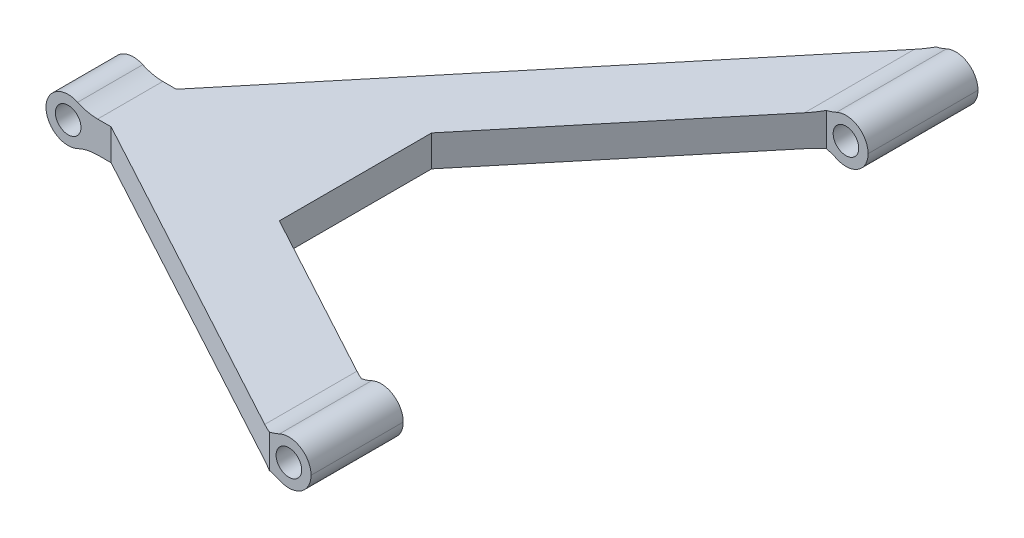
from build123d import *

# Parameters (mm, degrees)
BOSS_EXTRUDE1_DEPTH      = 2.38125
BOSS_EXTRUDE1_DEPTH_BACK = 2.38125
CUT_EXTRUDE1_DEPTH       = 68.891743782
CUT_EXTRUDE1_DEPTH_BACK  = 68.891743782
SKETCH2_R                = 1.375
FILLET2_R                = 2.38125
CUT_EXTRUDE2_DEPTH       = 61.804572212
CUT_EXTRUDE2_DEPTH_BACK  = 61.804572212


with BuildPart() as part:
    # Sketch1 → Boss-Extrude1 (new, two sides: drawn at the far end of the back side and taken through both)
    with BuildSketch(Plane(origin=(0, 0, 0), x_dir=(1, 0, 0), z_dir=(0, 1, 0)).offset(-BOSS_EXTRUDE1_DEPTH_BACK)):
        Polygon((0, 41.898993428), (-37, -2.75), (-44, -2.75), (-44, -9.75), (-37, -9.75), (0, -29.761006572), (4.489108528, -29.761006572), (4.489108528, -19.854089936), (0, -19.854089936), (-19.216520838, -9.461064942), (-19.216520838, 6.902295225), (0, 30.091438809), (4.489108528, 30.091438809), (4.489108528, 41.898993428), align=None)
    extrude(amount=BOSS_EXTRUDE1_DEPTH + BOSS_EXTRUDE1_DEPTH_BACK)

    # Sketch2 → Cut-Extrude1 (cut, two sides: drawn at the far end of the back side and taken through both)
    with BuildSketch(Plane.XY.offset(9.75).offset(-CUT_EXTRUDE1_DEPTH_BACK)):
        with Locations((-41.61875, 0)):
            Circle(SKETCH2_R)
        with Locations((2.107858528, 0)):
            Circle(SKETCH2_R)
    extrude(amount=CUT_EXTRUDE1_DEPTH + CUT_EXTRUDE1_DEPTH_BACK, mode=Mode.SUBTRACT)

    # Fillet2
    fillet2_edges = [part.edges().sort_by_distance(p)[0] for p in [
        (4.489108528, 2.38125, -35.995216119),
        (4.489108528, -2.38125, -35.995216119),
        (4.489108528, -2.38125, 24.807548254),
        (4.489108528, 2.38125, 24.807548254),
        (-44, -2.38125, 6.25),
        (-44, 2.38125, 6.25),
    ]]
    fillet(fillet2_edges, radius=FILLET2_R - 0.0001)  # a hair under: the kernel refuses the full size

    # Sketch3 → Cut-Extrude2 (cut, two sides: drawn at the far end of the back side and taken through both)
    with BuildSketch(Plane.XY.offset(-CUT_EXTRUDE2_DEPTH_BACK)):
        with BuildLine():
            Line((-38.450893086, -1.673565387), (-1.059998386, -1.673565387))
            ThreePointArc((-1.059998386, -1.673565387), (0.043808846, -1.795357088), (1.094509688, -2.154872546))
            ThreePointArc((1.094509688, -2.154872546), (1.588695109, -2.323966632), (2.107858528, -2.38125))
            Line((2.107858528, -2.38125), (2.107858528, -4.833118282))
            Line((2.107858528, -4.833118282), (-41.61875, -4.833118282))
            Line((-41.61875, -4.833118282), (-41.61875, -2.38125))
            ThreePointArc((-41.61875, -2.38125), (-41.099586581, -2.323966632), (-40.60540116, -2.154872546))
            ThreePointArc((-40.60540116, -2.154872546), (-39.554700318, -1.795357088), (-38.450893086, -1.673565387))
        make_face()
        with BuildLine():
            Line((2.107858528, 4.833118282), (2.107858528, 2.38125))
            ThreePointArc((2.107858528, 2.38125), (1.588695109, 2.323966632), (1.094509688, 2.154872546))
            ThreePointArc((1.094509688, 2.154872546), (0.043808846, 1.795357088), (-1.059998386, 1.673565387))
            Line((-1.059998386, 1.673565387), (-38.450893086, 1.673565387))
            ThreePointArc((-38.450893086, 1.673565387), (-39.554700318, 1.795357088), (-40.60540116, 2.154872546))
            ThreePointArc((-40.60540116, 2.154872546), (-41.099586581, 2.323966632), (-41.61875, 2.38125))
            Line((-41.61875, 2.38125), (-41.61875, 4.833118282))
            Line((-41.61875, 4.833118282), (2.107858528, 4.833118282))
        make_face()
    extrude(amount=CUT_EXTRUDE2_DEPTH + CUT_EXTRUDE2_DEPTH_BACK, mode=Mode.SUBTRACT)


solid = part.part
